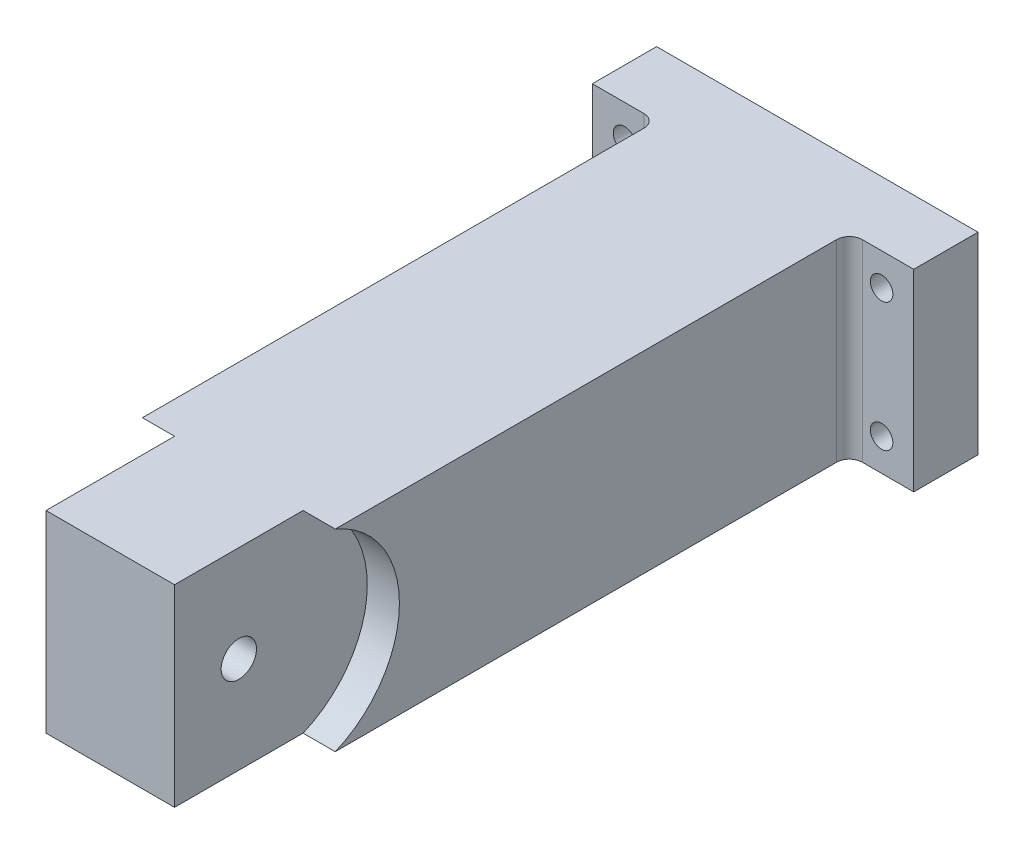
from build123d import *

# Parameters (mm, degrees)
ESQUISSE1_W             = 50
ESQUISSE1_H             = 30
BOSS_EXTRU_1_DEPTH      = 10
ESQUISSE2_W             = 30
ESQUISSE2_H             = 30
BOSS_EXTRU_2_DEPTH      = 100
ESQUISSE3_R             = 1.75
ENL_V_MAT_EXTRU_1_DEPTH = 116.758369028
CONG_1_R                = 2
ENL_V_MAT_EXTRU_3_DEPTH = 5
ESQUISSE6_R             = 2.75
ENL_V_MAT_EXTRU_4_DEPTH = 120.268604419


with BuildPart() as part:
    # Esquisse1 → Boss.-Extru.1 (new body)
    with BuildSketch(Plane.XY):
        with Locations((25, 15)):
            Rectangle(ESQUISSE1_W, ESQUISSE1_H)
    extrude(amount=BOSS_EXTRU_1_DEPTH)

    # Esquisse2 → Boss.-Extru.2 (add)
    with BuildSketch(Plane.XY.offset(10)):
        with Locations((25, 15)):
            Rectangle(ESQUISSE2_W, ESQUISSE2_H)
    extrude(amount=BOSS_EXTRU_2_DEPTH)

    # Esquisse3 → Enlèv. mat.-Extru.1 (cut, through all)
    with BuildSketch(Plane.XY.offset(10)):
        with Locations((45, 25)):
            Circle(ESQUISSE3_R)
        with Locations((45, 5)):
            Circle(ESQUISSE3_R)
        with Locations((5, 25)):
            Circle(ESQUISSE3_R)
        with Locations((5, 5)):
            Circle(ESQUISSE3_R)
    extrude(amount=-ENL_V_MAT_EXTRU_1_DEPTH, mode=Mode.SUBTRACT)

    # Congé1
    cong_1_edges = [part.edges().sort_by_distance(p)[0] for p in [
        (10, 15, 10),
        (40, 15, 10),
    ]]
    fillet(cong_1_edges, radius=CONG_1_R)

    # Esquisse5 → Enlèv. mat.-Extru.3 (cut)
    with BuildSketch(Plane.ZY.offset(-10)):
        with BuildLine():
            Line((110, 30), (90, 30))
            ThreePointArc((90, 30), (80.018651162, 15), (90, 0))
            Line((90, 0), (110, 0))
            Line((110, 0), (110, 30))
        make_face()
    enl_v_mat_extru_3 = extrude(amount=-ENL_V_MAT_EXTRU_3_DEPTH, mode=Mode.SUBTRACT)

    # Symétrie1: Enlèv. mat.-Extru.3 across plane
    add(enl_v_mat_extru_3.mirror(Plane.ZY.offset(-25)), mode=Mode.SUBTRACT)

    # Esquisse6 → Enlèv. mat.-Extru.4 (cut, through all)
    with BuildSketch(Plane.ZY.offset(-15)):
        with Locations((100, 15)):
            Circle(ESQUISSE6_R)
    extrude(amount=-ENL_V_MAT_EXTRU_4_DEPTH, mode=Mode.SUBTRACT)


solid = part.part
